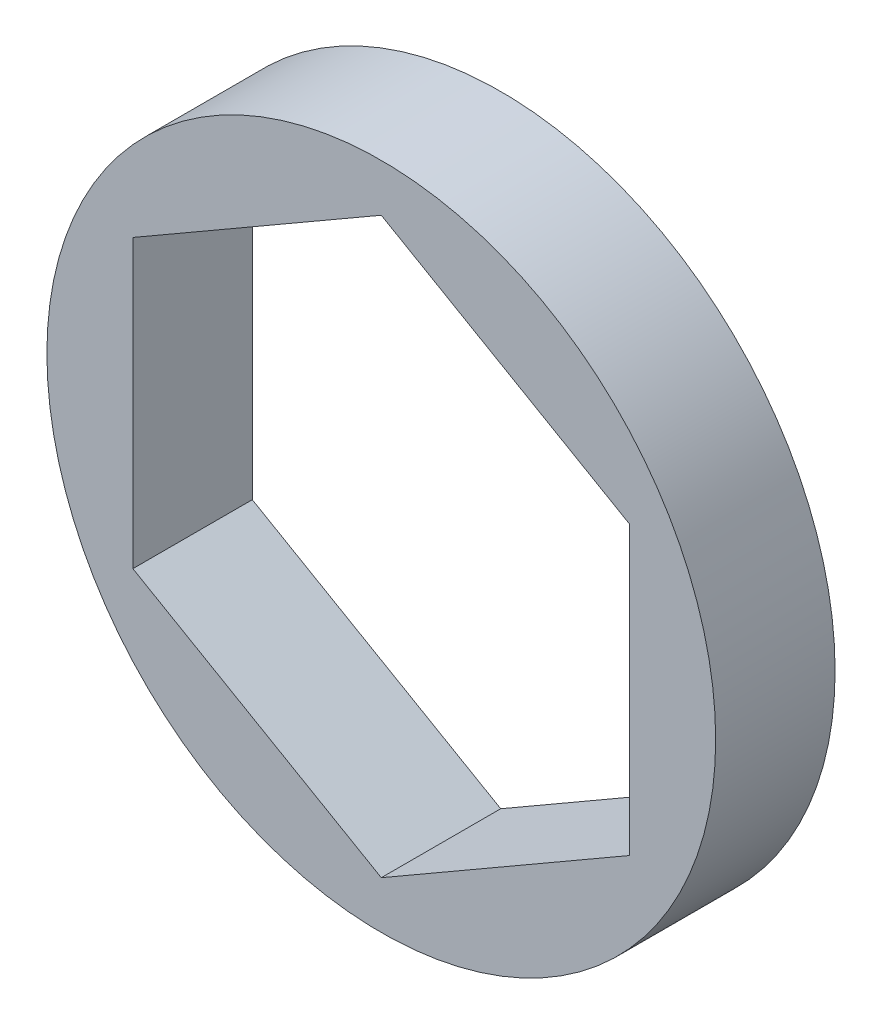
from build123d import *

# Parameters (mm, degrees)
SKETCH1_R           = 8.89
BOSS_EXTRUDE1_DEPTH = 1.5875


with BuildPart() as part:
    # Sketch1 → Boss-Extrude1 (new, symmetric)
    with BuildSketch(Plane.XY):
        Circle(SKETCH1_R)
        Polygon((0, 7.625642355), (-6.604, 3.812821178), (-6.604, -3.812821178), (0, -7.625642355), (6.604, -3.812821178), (6.604, 3.812821178), align=None, mode=Mode.SUBTRACT)
    extrude(amount=BOSS_EXTRUDE1_DEPTH, both=True)


solid = part.part
